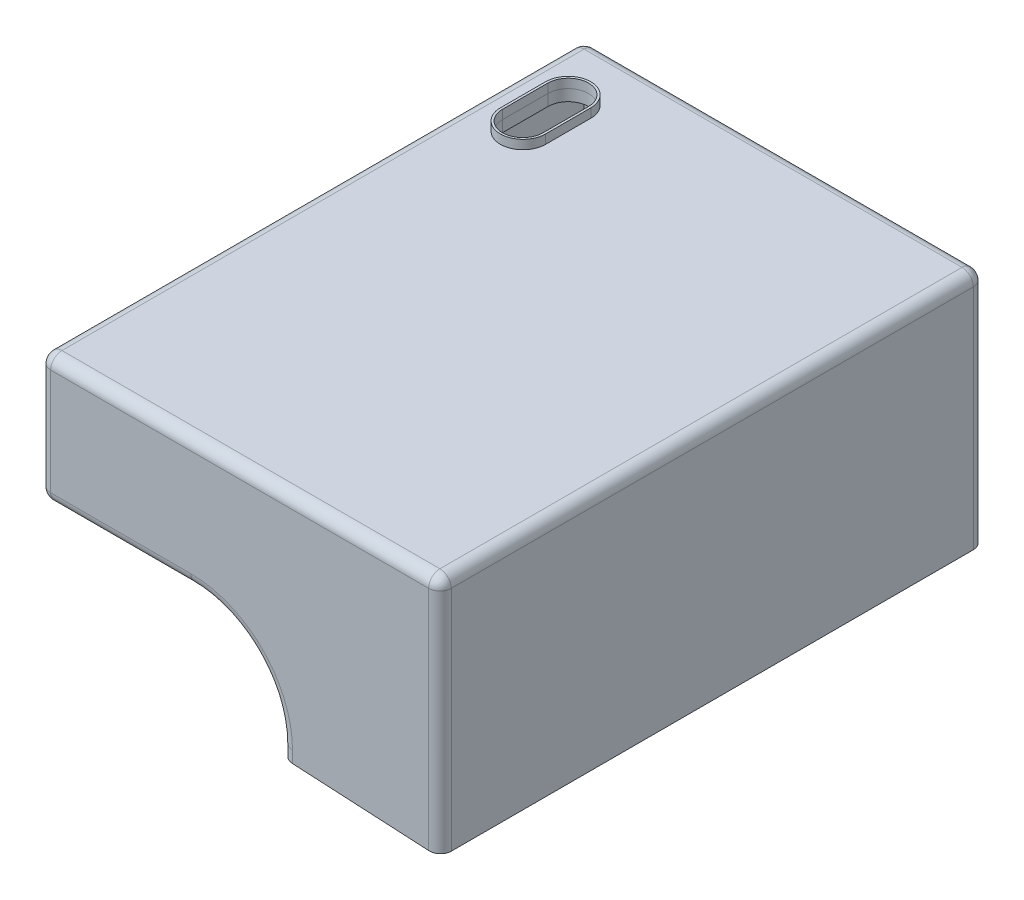
from build123d import *

# Parameters (mm, degrees)
BOSS_EXTRU_1_DEPTH      = 241
CONG_1_R                = 5
BOSS_EXTRU_2_DEPTH      = 4
ENL_V_MAT_EXTRU_2_DEPTH = 9
COQUE1_START            = 5
COQUE1_DEPTH            = 231


# Read off the part's stored shape, not the designer's step: Coque1
with BuildPart() as part:
    # Esquisse1 → Boss.-Extru.1 (new body)
    with BuildSketch(Plane.XY):
        with BuildLine():
            Line((5, 0), (67, 0))
            ThreePointArc((67, 0), (95.284271247, -11.715728753), (107, -40))
            Line((107, -40), (107, -45))
            Line((107, -45), (177.257535232, -48.743523889))
            Line((177.257535232, -48.743523889), (177.257535232, 52))
            ThreePointArc((177.257535232, 52), (175.793069138, 55.535533906), (172.257535232, 57))
            Line((172.257535232, 57), (5, 57))
            ThreePointArc((5, 57), (1.464466094, 55.535533906), (0, 52))
            Line((0, 52), (0, 5))
            ThreePointArc((0, 5), (1.464466094, 1.464466094), (5, 0))
        make_face()
    extrude(amount=BOSS_EXTRU_1_DEPTH)

    # Congé1
    cong_1_edges = [part.edges().sort_by_distance(p)[0] for p in [
        (107, -42.5, 0),
        (95.284271247, -11.715728753, 0),
        (36, 0, 0),
        (1.464466094, 1.464466094, 0),
        (0, 28.5, 0),
        (1.464466094, 55.535533906, 0),
        (88.628767616, 57, 0),
        (107, -42.5, 241),
        (95.284271247, -11.715728753, 241),
        (36, 0, 241),
        (0, 28.5, 241),
        (88.628767616, 57, 241),
        (177.257535232, 1.628238056, 0),
        (177.257535232, 1.628238056, 241),
    ]]
    fillet(cong_1_edges, radius=CONG_1_R)


with BuildPart() as body_2:
    # Esquisse3 → Boss.-Extru.2 (new body)
    with BuildSketch(Plane(origin=(0, 57, 0), x_dir=(1, 0, 0), z_dir=(0, 1, 0))):
        with BuildLine():
            Line((13, -30), (13, -50))
            ThreePointArc((13, -50), (23, -60), (33, -50))
            Line((33, -50), (33, -30))
            ThreePointArc((33, -30), (23, -20), (13, -30))
        make_face()
    extrude(amount=BOSS_EXTRU_2_DEPTH)


with BuildPart() as enl_v_mat_extru_2_tool:
    # Esquisse5 → Enlèv. mat.-Extru.2 (new body)
    with BuildSketch(Plane(origin=(0, 61, 0), x_dir=(1, 0, 0), z_dir=(0, 1, 0))):
        with BuildLine():
            Line((14.002264258, -30), (14.002264258, -50.088867222))
            ThreePointArc((14.002264258, -50.088867222), (23.001132129, -59.087735093), (32, -50.088867222))
            Line((32, -50.088867222), (32, -30))
            ThreePointArc((32, -30), (23.001132129, -21.001132129), (14.002264258, -30))
        make_face()
    extrude(amount=-ENL_V_MAT_EXTRU_2_DEPTH)


with BuildPart() as part_1:
    add(part.part)

    # Enlèv. mat.-Extru.2: cut by enl_v_mat_extru_2_tool
    add(enl_v_mat_extru_2_tool.part, mode=Mode.SUBTRACT)

    # Coque1 outline → Coque1 (cut)
    with BuildSketch(Plane.XY.offset(COQUE1_START)):
        with BuildLine():
            Line((172.257535232, 52), (5, 52))
            Line((5, 52), (5, 5))
            Line((5, 5), (67, 5))
            ThreePointArc((67, 5), (98.819805153, -8.180194847), (112, -40))
            Line((112, -40), (112, -40.259321772))
            Line((112, -40.259321772), (172.257535232, -43.470016851))
            Line((172.257535232, -43.470016851), (172.257535232, 52))
        make_face()
    extrude(amount=COQUE1_DEPTH, mode=Mode.SUBTRACT)


with BuildPart() as body_2_1:
    add(body_2.part)

    # Enlèv. mat.-Extru.2: cut by enl_v_mat_extru_2_tool
    add(enl_v_mat_extru_2_tool.part, mode=Mode.SUBTRACT)


solid = Compound([part_1.part, body_2_1.part])
